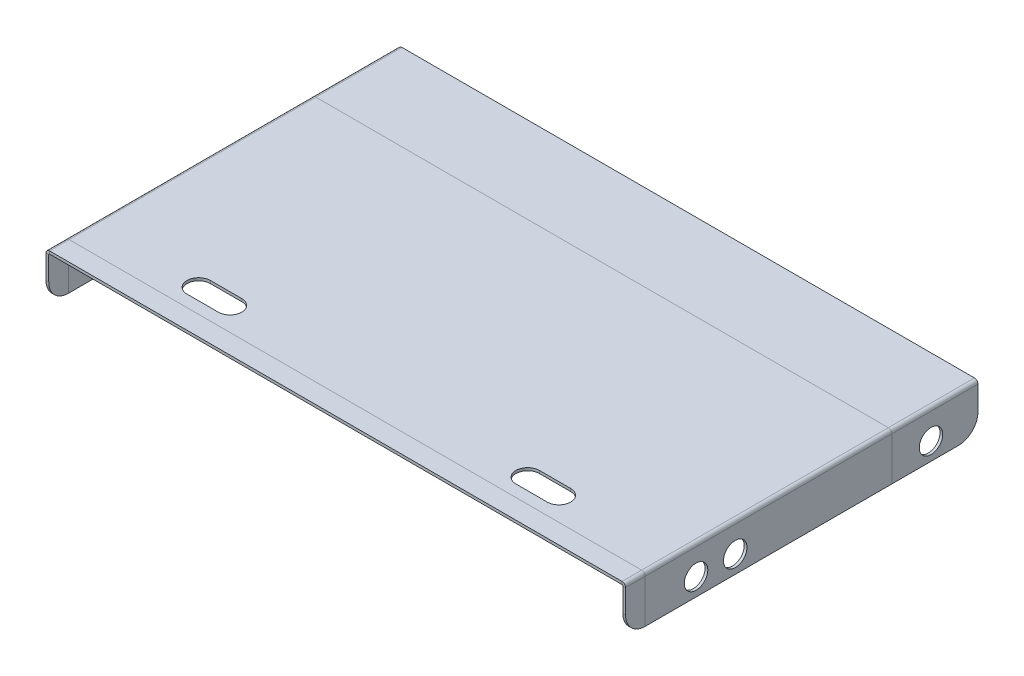
from build123d import *

# Parameters (mm, degrees)
SKETCH_1_W                         = 148
SKETCH_1_H                         = 90
SM_BASE_FLANGE_1_DEPTH             = 0.7
SM_EDGE_FLANGE_1_STRIP_W           = 3.2
SM_EDGE_FLANGE_1_STRIP_H           = 0.7
SM_EDGE_FLANGE_1_STRIP_CUT_DEPTH   = 90
SM_EDGE_FLANGE_1_STRIP_2_W         = 3.2
SM_EDGE_FLANGE_1_STRIP_2_H         = 0.7
SM_EDGE_FLANGE_1_STRIP_CUT_2_DEPTH = 90
SM_EDGE_FLANGE_1_DEPTH             = 90
SM_EDGE_FLANGE_1_PROFILE_W         = 90
SM_EDGE_FLANGE_1_PROFILE_H         = 11.1
SM_EDGE_FLANGE_1_PROFILE_R         = 3
SM_EDGE_FLANGE_1_FLAT_DEPTH        = 0.7
SM_EDGE_FLANGE_1_BEND_DEPTH        = 90
FILLET_2_R                         = 5
CUT_EXTRUDE_START                  = -10
SKETCH_15_R                        = 3
CUT_EXTRUDE_1_DEPTH                = 10
SPLIT_BODIES_1_SURFACE_1_1_BACK    = 174.632
SPLIT_BODIES_1_SURFACE_1_1_DEPTH   = 349.264
SPLIT_BODIES_1_SURFACE_1_2_BACK    = 174.632
SPLIT_BODIES_1_SURFACE_1_2_DEPTH   = 349.264
SPLIT_BODIES_1_SURFACE_2_3_BACK    = 174.632
SPLIT_BODIES_1_SURFACE_2_3_DEPTH   = 349.264
SPLIT_BODIES_1_SURFACE_2_4_BACK    = 174.632
SPLIT_BODIES_1_SURFACE_2_4_DEPTH   = 349.264


# Sheet-metal steps are written as plain solids
with BuildPart() as part:
    # Sketch 1 → 基体-法兰1 (new body)
    with BuildSketch(Plane(origin=(0, 0, 0), x_dir=(1, 0, 0), z_dir=(0, 1, 0))):
        Rectangle(SKETCH_1_W, SKETCH_1_H)
        with BuildLine():
            Line((-46, -31), (-38, -31))
            ThreePointArc((-38, -31), (-35, -34), (-38, -37))
            Line((-38, -37), (-46, -37))
            ThreePointArc((-46, -37), (-49, -34), (-46, -31))
        make_face(mode=Mode.SUBTRACT)
        with BuildLine():
            Line((38, -31), (46, -31))
            ThreePointArc((46, -31), (49, -34), (46, -37))
            Line((46, -37), (38, -37))
            ThreePointArc((38, -37), (35, -34), (38, -31))
        make_face(mode=Mode.SUBTRACT)
    extrude(amount=-SM_BASE_FLANGE_1_DEPTH)

    # 边线-法兰1 strip (across the edge) → 边线-法兰1 strip cut (cut)
    with BuildSketch(Plane(origin=(74, -0.7, -45), x_dir=(-1, 0, 0), z_dir=(0, 0, 1))):
        with Locations((-0.7, -0.35)):
            Rectangle(SM_EDGE_FLANGE_1_STRIP_W, SM_EDGE_FLANGE_1_STRIP_H)
    extrude(amount=SM_EDGE_FLANGE_1_STRIP_CUT_DEPTH, mode=Mode.SUBTRACT)

    # 边线-法兰1 strip 2 (across the edge) → 边线-法兰1 strip cut 2 (cut)
    with BuildSketch(Plane(origin=(-74, -0.7, 45), x_dir=(1, 0, 0), z_dir=(0, 0, -1))):
        with Locations((-0.7, -0.35)):
            Rectangle(SM_EDGE_FLANGE_1_STRIP_2_W, SM_EDGE_FLANGE_1_STRIP_2_H)
    extrude(amount=SM_EDGE_FLANGE_1_STRIP_CUT_2_DEPTH, mode=Mode.SUBTRACT)

    # 边线-法兰1 bend section (across the edge) → 边线-法兰1 (add)
    with BuildSketch(Plane(origin=(74, -0.7, -45), x_dir=(-1, 0, 0), z_dir=(0, 0, 1))):
        with BuildLine():
            Line((0, 0.2), (0.7, 0.2))
            ThreePointArc((0.7, 0.2), (0.758578644, 0.058578644), (0.9, 0))
            Line((0.9, 0), (0.9, -0.7))
            ThreePointArc((0.9, -0.7), (0.263603897, -0.436396103), (0, 0.2))
        make_face()
    extrude(amount=SM_EDGE_FLANGE_1_DEPTH)

    # 边线-法兰1 profile (on flange) → 边线-法兰1 flat (add)
    with BuildSketch(Plane(origin=(74, -0.7, 0), x_dir=(0, 0, 1), z_dir=(1, 0, 0))):
        with Locations((0, 5.75)):
            Rectangle(SM_EDGE_FLANGE_1_PROFILE_W, SM_EDGE_FLANGE_1_PROFILE_H)
        with Locations((17, 6.8)):
            Circle(SM_EDGE_FLANGE_1_PROFILE_R, mode=Mode.SUBTRACT)
        with Locations((27, 6.8)):
            Circle(SM_EDGE_FLANGE_1_PROFILE_R, mode=Mode.SUBTRACT)
        with Locations((-33, 6.8)):
            Circle(SM_EDGE_FLANGE_1_PROFILE_R, mode=Mode.SUBTRACT)
    extrude(amount=-SM_EDGE_FLANGE_1_FLAT_DEPTH)

    # 边线-法兰1 section (across the edge) → 边线-法兰1 bend (add)
    with BuildSketch(Plane(origin=(-74, -0.7, 45), x_dir=(1, 0, 0), z_dir=(0, 0, -1))):
        with BuildLine():
            Line((0, 0.2), (0, 11.3))
            Line((0, 11.3), (0.7, 11.3))
            Line((0.7, 11.3), (0.7, 0.2))
            ThreePointArc((0.7, 0.2), (0.758578644, 0.058578644), (0.9, 0))
            Line((0.9, 0), (0.9, -0.7))
            ThreePointArc((0.9, -0.7), (0.263603897, -0.436396103), (0, 0.2))
        make_face()
    extrude(amount=SM_EDGE_FLANGE_1_BEND_DEPTH)

    # 圆角2
    fillet_2_edges = [part.edges().sort_by_distance(p)[0] for p in [
        (-73.65, -12, 45),
        (-73.65, -12, -45),
        (73.65, -12, -45),
        (73.65, -12, 45),
    ]]
    fillet(fillet_2_edges, radius=FILLET_2_R)

    # 草图15 → 切除-拉伸1 (cut)
    with BuildSketch(Plane.ZY.offset(74).offset(CUT_EXTRUDE_START)):
        with Locations(Location((-33, -7.5, 0), (0, 0, 270))):
            Circle(SKETCH_15_R)
        with Locations(Location((17, -7.5, 0), (0, 0, 270))):
            Circle(SKETCH_15_R)
        with Locations(Location((27, -7.5, 0), (0, 0, 270))):
            Circle(SKETCH_15_R)
    extrude(amount=CUT_EXTRUDE_1_DEPTH, mode=Mode.SUBTRACT)


with BuildPart() as body_2:
    # Split Bodies 1: the piece behind the surface
    add(part.part)
    # Split Bodies 1 surface 1: a surface, the sketch's curves swept straight by 349.264 mm
    with BuildLine(Plane(origin=(0, 0, 0), x_dir=(1, 0, 0), z_dir=(0, 1, 0)).offset(-SPLIT_BODIES_1_SURFACE_1_1_BACK), mode=Mode.PRIVATE) as split_bodies_1_surface_1_1_path:
        Line((-74, 23), (74, 23))
    split_bodies_1_surface_1_1 = Shell.extrude(split_bodies_1_surface_1_1_path.wire(), (0 * SPLIT_BODIES_1_SURFACE_1_1_DEPTH, 1 * SPLIT_BODIES_1_SURFACE_1_1_DEPTH, 0 * SPLIT_BODIES_1_SURFACE_1_1_DEPTH))
    split(bisect_by=split_bodies_1_surface_1_1, keep=Keep.BOTTOM)


with BuildPart() as part_1:
    add(part.part)

    # Split Bodies 1: split by a surface, the side it looks to stays
    # Split Bodies 1 surface 1: a surface, the sketch's curves swept straight by 349.264 mm
    with BuildLine(Plane(origin=(0, 0, 0), x_dir=(1, 0, 0), z_dir=(0, 1, 0)).offset(-SPLIT_BODIES_1_SURFACE_1_2_BACK), mode=Mode.PRIVATE) as split_bodies_1_surface_1_2_path:
        Line((-74, 23), (74, 23))
    split_bodies_1_surface_1_2 = Shell.extrude(split_bodies_1_surface_1_2_path.wire(), (0 * SPLIT_BODIES_1_SURFACE_1_2_DEPTH, 1 * SPLIT_BODIES_1_SURFACE_1_2_DEPTH, 0 * SPLIT_BODIES_1_SURFACE_1_2_DEPTH))
    split(bisect_by=split_bodies_1_surface_1_2, keep=Keep.TOP)


with BuildPart() as body_3:
    # Split Bodies 1 2 body 2: the piece behind the surface
    add(body_2.part)
    # Split Bodies 1 surface 2: a surface, the sketch's curves swept straight by 349.264 mm
    with BuildLine(Plane(origin=(0, 0, 0), x_dir=(1, 0, 0), z_dir=(0, 1, 0)).offset(-SPLIT_BODIES_1_SURFACE_2_3_BACK), mode=Mode.PRIVATE) as split_bodies_1_surface_2_3_path:
        Line((-74, -40), (74, -40))
    split_bodies_1_surface_2_3 = Shell.extrude(split_bodies_1_surface_2_3_path.wire(), (0 * SPLIT_BODIES_1_SURFACE_2_3_DEPTH, 1 * SPLIT_BODIES_1_SURFACE_2_3_DEPTH, 0 * SPLIT_BODIES_1_SURFACE_2_3_DEPTH))
    split(bisect_by=split_bodies_1_surface_2_3, keep=Keep.BOTTOM)


with BuildPart() as body_2_1:
    add(body_2.part)

    # Split Bodies 1 2 body 2: split by a surface, the side it looks to stays
    # Split Bodies 1 surface 2: a surface, the sketch's curves swept straight by 349.264 mm
    with BuildLine(Plane(origin=(0, 0, 0), x_dir=(1, 0, 0), z_dir=(0, 1, 0)).offset(-SPLIT_BODIES_1_SURFACE_2_4_BACK), mode=Mode.PRIVATE) as split_bodies_1_surface_2_4_path:
        Line((-74, -40), (74, -40))
    split_bodies_1_surface_2_4 = Shell.extrude(split_bodies_1_surface_2_4_path.wire(), (0 * SPLIT_BODIES_1_SURFACE_2_4_DEPTH, 1 * SPLIT_BODIES_1_SURFACE_2_4_DEPTH, 0 * SPLIT_BODIES_1_SURFACE_2_4_DEPTH))
    split(bisect_by=split_bodies_1_surface_2_4, keep=Keep.TOP)


solid = Compound([part_1.part, body_3.part, body_2_1.part])
